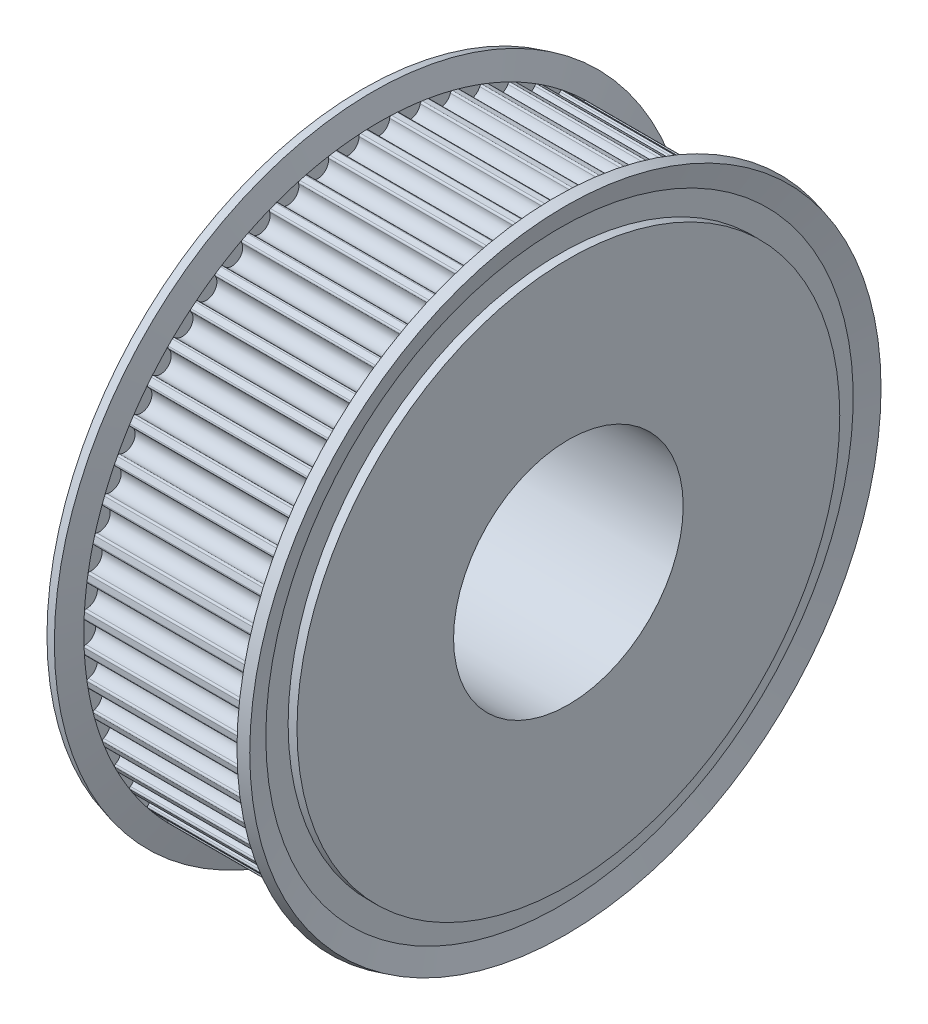
from build123d import *

# Parameters (mm, degrees)
CUT_EXTRUDE1_DEPTH       = 8.15
CUT_EXTRUDE1_DEPTH_BACK  = 8.15
CUT_EXTRUDE2_DEPTH       = 8.15
CUT_EXTRUDE2_DEPTH_BACK  = 8.15
CUT_EXTRUDE3_DEPTH       = 8.15
CUT_EXTRUDE3_DEPTH_BACK  = 8.15
CUT_EXTRUDE4_DEPTH       = 8.15
CUT_EXTRUDE4_DEPTH_BACK  = 8.15
CUT_EXTRUDE5_DEPTH       = 8.15
CUT_EXTRUDE5_DEPTH_BACK  = 8.15
CUT_EXTRUDE6_DEPTH       = 8.15
CUT_EXTRUDE6_DEPTH_BACK  = 8.15
CUT_EXTRUDE7_DEPTH       = 8.15
CUT_EXTRUDE7_DEPTH_BACK  = 8.15
CUT_EXTRUDE8_DEPTH       = 8.15
CUT_EXTRUDE8_DEPTH_BACK  = 8.15
CUT_EXTRUDE9_DEPTH       = 8.15
CUT_EXTRUDE9_DEPTH_BACK  = 8.15
CUT_EXTRUDE10_DEPTH      = 8.15
CUT_EXTRUDE10_DEPTH_BACK = 8.15
CUT_EXTRUDE11_DEPTH      = 8.15
CUT_EXTRUDE11_DEPTH_BACK = 8.15
CUT_EXTRUDE12_DEPTH      = 8.15
CUT_EXTRUDE12_DEPTH_BACK = 8.15
CUT_EXTRUDE13_DEPTH      = 8.15
CUT_EXTRUDE13_DEPTH_BACK = 8.15
CUT_EXTRUDE14_DEPTH      = 8.15
CUT_EXTRUDE14_DEPTH_BACK = 8.15
CUT_EXTRUDE15_DEPTH      = 8.15
CUT_EXTRUDE15_DEPTH_BACK = 8.15
CUT_EXTRUDE16_DEPTH      = 8.15
CUT_EXTRUDE16_DEPTH_BACK = 8.15
CUT_EXTRUDE17_DEPTH      = 8.15
CUT_EXTRUDE17_DEPTH_BACK = 8.15
CUT_EXTRUDE18_DEPTH      = 8.15
CUT_EXTRUDE18_DEPTH_BACK = 8.15
CUT_EXTRUDE19_DEPTH      = 8.15
CUT_EXTRUDE19_DEPTH_BACK = 8.15
CUT_EXTRUDE20_DEPTH      = 8.15
CUT_EXTRUDE20_DEPTH_BACK = 8.15
CUT_EXTRUDE21_DEPTH      = 8.15
CUT_EXTRUDE21_DEPTH_BACK = 8.15
CUT_EXTRUDE22_DEPTH      = 8.15
CUT_EXTRUDE22_DEPTH_BACK = 8.15
CUT_EXTRUDE23_DEPTH      = 8.15
CUT_EXTRUDE23_DEPTH_BACK = 8.15
CUT_EXTRUDE24_DEPTH      = 8.15
CUT_EXTRUDE24_DEPTH_BACK = 8.15
CUT_EXTRUDE25_DEPTH      = 8.15
CUT_EXTRUDE25_DEPTH_BACK = 8.15
CUT_EXTRUDE26_DEPTH      = 8.15
CUT_EXTRUDE26_DEPTH_BACK = 8.15
CUT_EXTRUDE27_DEPTH      = 8.15
CUT_EXTRUDE27_DEPTH_BACK = 8.15
CUT_EXTRUDE28_DEPTH      = 8.15
CUT_EXTRUDE28_DEPTH_BACK = 8.15
CUT_EXTRUDE29_DEPTH      = 8.15
CUT_EXTRUDE29_DEPTH_BACK = 8.15
CUT_EXTRUDE30_DEPTH      = 8.15
CUT_EXTRUDE30_DEPTH_BACK = 8.15
CUT_EXTRUDE31_DEPTH      = 8.15
CUT_EXTRUDE31_DEPTH_BACK = 8.15
CUT_EXTRUDE32_DEPTH      = 8.15
CUT_EXTRUDE32_DEPTH_BACK = 8.15
CUT_EXTRUDE33_DEPTH      = 8.15
CUT_EXTRUDE33_DEPTH_BACK = 8.15
CUT_EXTRUDE34_DEPTH      = 8.15
CUT_EXTRUDE34_DEPTH_BACK = 8.15
CUT_EXTRUDE35_DEPTH      = 8.15
CUT_EXTRUDE35_DEPTH_BACK = 8.15
CUT_EXTRUDE36_DEPTH      = 8.15
CUT_EXTRUDE36_DEPTH_BACK = 8.15
CUT_EXTRUDE37_DEPTH      = 8.15
CUT_EXTRUDE37_DEPTH_BACK = 8.15
CUT_EXTRUDE38_DEPTH      = 8.15
CUT_EXTRUDE38_DEPTH_BACK = 8.15
CUT_EXTRUDE39_DEPTH      = 8.15
CUT_EXTRUDE39_DEPTH_BACK = 8.15
CUT_EXTRUDE40_DEPTH      = 8.15
CUT_EXTRUDE40_DEPTH_BACK = 8.15
CUT_EXTRUDE41_DEPTH      = 8.15
CUT_EXTRUDE41_DEPTH_BACK = 8.15
CUT_EXTRUDE42_DEPTH      = 8.15
CUT_EXTRUDE42_DEPTH_BACK = 8.15
CUT_EXTRUDE43_DEPTH      = 8.15
CUT_EXTRUDE43_DEPTH_BACK = 8.15
CUT_EXTRUDE44_DEPTH      = 8.15
CUT_EXTRUDE44_DEPTH_BACK = 8.15
CUT_EXTRUDE45_DEPTH      = 8.15
CUT_EXTRUDE45_DEPTH_BACK = 8.15
CUT_EXTRUDE46_DEPTH      = 8.15
CUT_EXTRUDE46_DEPTH_BACK = 8.15
CUT_EXTRUDE47_DEPTH      = 8.15
CUT_EXTRUDE47_DEPTH_BACK = 8.15
CUT_EXTRUDE48_DEPTH      = 8.15
CUT_EXTRUDE48_DEPTH_BACK = 8.15
CUT_EXTRUDE49_DEPTH      = 8.15
CUT_EXTRUDE49_DEPTH_BACK = 8.15
CUT_EXTRUDE50_DEPTH      = 8.15
CUT_EXTRUDE50_DEPTH_BACK = 8.15
CUT_EXTRUDE51_DEPTH      = 8.15
CUT_EXTRUDE51_DEPTH_BACK = 8.15
CUT_EXTRUDE52_DEPTH      = 8.15
CUT_EXTRUDE52_DEPTH_BACK = 8.15
CUT_EXTRUDE53_DEPTH      = 8.15
CUT_EXTRUDE53_DEPTH_BACK = 8.15
CUT_EXTRUDE54_DEPTH      = 8.15
CUT_EXTRUDE54_DEPTH_BACK = 8.15
CUT_EXTRUDE55_DEPTH      = 8.15
CUT_EXTRUDE55_DEPTH_BACK = 8.15
CUT_EXTRUDE56_DEPTH      = 8.15
CUT_EXTRUDE56_DEPTH_BACK = 8.15
CUT_EXTRUDE57_DEPTH      = 8.15
CUT_EXTRUDE57_DEPTH_BACK = 8.15
CUT_EXTRUDE58_DEPTH      = 8.15
CUT_EXTRUDE58_DEPTH_BACK = 8.15
CUT_EXTRUDE59_DEPTH      = 8.15
CUT_EXTRUDE59_DEPTH_BACK = 8.15
CUT_EXTRUDE60_DEPTH      = 8.15
CUT_EXTRUDE60_DEPTH_BACK = 8.15
SKETCH62_W               = 20
SKETCH62_H               = 11


with BuildPart() as part:
    # Sketch1 → Revolve1 (revolve)
    with BuildSketch(Plane.XY):
        Polygon((0, 0), (0, 26), (0.85, 26), (0.85, 28.138347502), (0.286547475, 30.241180955), (1.252473301, 30.5), (1.85, 28.27), (18.15, 28.27), (18.747526699, 30.5), (19.713452525, 30.241180955), (19.15, 28.138347502), (19.15, 26), (20, 26), (20, 0), align=None)
    revolve(axis=Axis((20, 0, 0), (-1, 0, 0)))

    # Sketch2 → Cut-Extrude1 (cut, two sides: drawn at the far end of the back side and taken through both)
    with BuildSketch(Plane(origin=(10, 0, 0), x_dir=(0, 0, -1), z_dir=(1, 0, 0)).offset(-CUT_EXTRUDE1_DEPTH_BACK)):
        with BuildLine():
            Line((-1.220377727, 28.623996545), (-1.204191216, 28.244341442))
            ThreePointArc((-1.204191216, 28.244341442), (-1.083780205, 28.201352445), (-1.027381979, 28.086608793))
            ThreePointArc((-1.027381979, 28.086608793), (5e-08, 27.13), (1.027381986, 28.086608894))
            ThreePointArc((1.027381986, 28.086608894), (1.083780242, 28.201352479), (1.204191216, 28.244341442))
            Line((1.204191216, 28.244341442), (1.220377727, 28.623996545))
            ThreePointArc((1.220377727, 28.623996545), (0, 28.65), (-1.220377727, 28.623996545))
        make_face()
    extrude(amount=CUT_EXTRUDE1_DEPTH + CUT_EXTRUDE1_DEPTH_BACK, mode=Mode.SUBTRACT)

    # Sketch3 → Cut-Extrude2 (cut, two sides: drawn at the far end of the back side and taken through both)
    with BuildSketch(Plane(origin=(10, 0, 0), x_dir=(0, 0, -1), z_dir=(1, 0, 0)).offset(-CUT_EXTRUDE2_DEPTH_BACK)):
        with BuildLine():
            Line((-4.205714742, 28.339627088), (-4.149932138, 27.963743727))
            ThreePointArc((-4.149932138, 27.963743727), (-4.025687177, 27.933576607), (-3.957603929, 27.825356752))
            ThreePointArc((-3.957603929, 27.825356752), (-2.835857158, 26.981379027), (-1.914096186, 28.040138172))
            ThreePointArc((-1.914096186, 28.040138172), (-1.870000856, 28.160148403), (-1.754743076, 28.215488242))
            Line((-1.754743076, 28.215488242), (-1.778330001, 28.594755505))
            ThreePointArc((-1.778330001, 28.594755505), (-2.994740473, 28.493052302), (-4.205714742, 28.339627088))
        make_face()
    extrude(amount=CUT_EXTRUDE2_DEPTH + CUT_EXTRUDE2_DEPTH_BACK, mode=Mode.SUBTRACT)

    # Sketch4 → Cut-Extrude3 (cut, two sides: drawn at the far end of the back side and taken through both)
    with BuildSketch(Plane(origin=(10, 0, 0), x_dir=(0, 0, -1), z_dir=(1, 0, 0)).offset(-CUT_EXTRUDE3_DEPTH_BACK)):
        with BuildLine():
            Line((-7.144973065, 27.744762747), (-7.050205534, 27.376769384))
            ThreePointArc((-7.050205534, 27.376769384), (-6.923487877, 27.359754657), (-6.844465541, 27.25924428))
            ThreePointArc((-6.844465541, 27.25924428), (-5.640644123, 26.537144418), (-4.83460312, 27.686453828))
            ThreePointArc((-4.83460312, 27.686453828), (-4.803293833, 27.810415847), (-4.694452036, 27.877500248))
            Line((-4.694452036, 27.877500248), (-4.757553974, 28.252224341))
            ThreePointArc((-4.757553974, 28.252224341), (-5.956669942, 28.023928761), (-7.144973065, 27.744762747))
        make_face()
    extrude(amount=CUT_EXTRUDE3_DEPTH + CUT_EXTRUDE3_DEPTH_BACK, mode=Mode.SUBTRACT)

    # Sketch5 → Cut-Extrude4 (cut, two sides: drawn at the far end of the back side and taken through both)
    with BuildSketch(Plane(origin=(10, 0, 0), x_dir=(0, 0, -1), z_dir=(1, 0, 0)).offset(-CUT_EXTRUDE4_DEPTH_BACK)):
        with BuildLine():
            Line((-10.005949569, 26.845920979), (-9.873235404, 26.489849427))
            ThreePointArc((-9.873235404, 26.489849427), (-9.745433396, 26.48617351), (-9.656337757, 26.394473822))
            ThreePointArc((-9.656337757, 26.394473822), (-8.383631009, 25.802163303), (-7.70214113, 27.029430903))
            ThreePointArc((-7.70214113, 27.029430903), (-7.683960919, 27.155986556), (-7.582727597, 27.234080528))
            Line((-7.582727597, 27.234080528), (-7.68465319, 27.600155894))
            ThreePointArc((-7.68465319, 27.600155894), (-8.853336889, 27.247769192), (-10.005949569, 26.845920979))
        make_face()
    extrude(amount=CUT_EXTRUDE4_DEPTH + CUT_EXTRUDE4_DEPTH_BACK, mode=Mode.SUBTRACT)

    # Sketch6 → Cut-Extrude5 (cut, two sides: drawn at the far end of the back side and taken through both)
    with BuildSketch(Plane(origin=(10, 0, 0), x_dir=(0, 0, -1), z_dir=(1, 0, 0)).offset(-CUT_EXTRUDE5_DEPTH_BACK)):
        with BuildLine():
            Line((-12.757298795, 25.652949683), (-12.58809204, 25.312701136))
            ThreePointArc((-12.58809204, 25.312701136), (-12.460605907, 25.322404304), (-12.362413116, 25.240519986))
            ThreePointArc((-12.362413116, 25.240519986), (-11.034765081, 24.784488286), (-10.48529287, 26.076267876))
            ThreePointArc((-10.48529287, 26.076267876), (-10.48044092, 26.204030594), (-10.387925208, 26.292278522))
            Line((-10.387925208, 26.292278522), (-10.527557737, 26.645694363))
            ThreePointArc((-10.527557737, 26.645694363), (-11.653004824, 26.173077361), (-12.757298795, 25.652949683))
        make_face()
    extrude(amount=CUT_EXTRUDE5_DEPTH + CUT_EXTRUDE5_DEPTH_BACK, mode=Mode.SUBTRACT)

    # Sketch7 → Cut-Extrude6 (cut, two sides: drawn at the far end of the back side and taken through both)
    with BuildSketch(Plane(origin=(10, 0, 0), x_dir=(0, 0, -1), z_dir=(1, 0, 0)).offset(-CUT_EXTRUDE6_DEPTH_BACK)):
        with BuildLine():
            Line((-15.368876386, 24.178919302), (-15.165030906, 23.858221594))
            ThreePointArc((-15.165030906, 23.858221594), (-15.039257412, 23.881197536), (-14.93304329, 23.810025732))
            ThreePointArc((-14.93304329, 23.810025732), (-13.564999956, 23.49526923), (-13.153565547, 24.837407801))
            ThreePointArc((-13.153565547, 24.837407801), (-13.162095017, 24.964977789), (-13.079310537, 25.06241281))
            Line((-13.079310537, 25.06241281), (-13.255120158, 25.399297029))
            ThreePointArc((-13.255120158, 25.399297029), (-14.325, 24.811627818), (-15.368876386, 24.178919302))
        make_face()
    extrude(amount=CUT_EXTRUDE6_DEPTH + CUT_EXTRUDE6_DEPTH_BACK, mode=Mode.SUBTRACT)

    # Sketch8 → Cut-Extrude7 (cut, two sides: drawn at the far end of the back side and taken through both)
    with BuildSketch(Plane(origin=(10, 0, 0), x_dir=(0, 0, -1), z_dir=(1, 0, 0)).offset(-CUT_EXTRUDE7_DEPTH_BACK)):
        with BuildLine():
            Line((-17.812069352, 22.439979621), (-17.575818519, 22.142346384))
            ThreePointArc((-17.575818519, 22.142346384), (-17.453135666, 22.178343372), (-17.340063916, 22.118663852))
            ThreePointArc((-17.340063916, 22.118663852), (-15.946613854, 21.948631087), (-15.677725008, 23.326423889))
            ThreePointArc((-15.677725008, 23.326423889), (-15.699542448, 23.452403463), (-15.627396202, 23.55795806))
            Line((-15.627396202, 23.55795806), (-15.83745671, 23.874619682))
            ThreePointArc((-15.83745671, 23.874619682), (-16.840047478, 23.178336889), (-17.812069352, 22.439979621))
        make_face()
    extrude(amount=CUT_EXTRUDE7_DEPTH + CUT_EXTRUDE7_DEPTH_BACK, mode=Mode.SUBTRACT)

    # Sketch9 → Cut-Extrude8 (cut, two sides: drawn at the far end of the back side and taken through both)
    with BuildSketch(Plane(origin=(10, 0, 0), x_dir=(0, 0, -1), z_dir=(1, 0, 0)).offset(-CUT_EXTRUDE8_DEPTH_BACK)):
        with BuildLine():
            Line((-20.060109558, 20.455182828), (-19.794041787, 20.183874993))
            ThreePointArc((-19.794041787, 20.183874993), (-19.675793713, 20.232498636), (-19.557103174, 20.184965263))
            ThreePointArc((-19.557103174, 20.184965263), (-18.153513313, 20.161519149), (-18.030116033, 21.559870796))
            ThreePointArc((-18.030116033, 21.559870796), (-18.064982405, 21.682879697), (-18.004264844, 21.795397391))
            Line((-18.004264844, 21.795397391), (-18.246274771, 22.088367005))
            ThreePointArc((-18.246274771, 22.088367005), (-19.170591872, 21.29109925), (-20.060109558, 20.455182828))
        make_face()
    extrude(amount=CUT_EXTRUDE8_DEPTH + CUT_EXTRUDE8_DEPTH_BACK, mode=Mode.SUBTRACT)

    # Sketch10 → Cut-Extrude9 (cut, two sides: drawn at the far end of the back side and taken through both)
    with BuildSketch(Plane(origin=(10, 0, 0), x_dir=(0, 0, -1), z_dir=(1, 0, 0)).offset(-CUT_EXTRUDE9_DEPTH_BACK)):
        with BuildLine():
            Line((-22.088367005, 18.246274771), (-21.795397391, 18.004264844))
            ThreePointArc((-21.795397391, 18.004264844), (-21.682879647, 18.064982411), (-21.559870717, 18.030115971))
            ThreePointArc((-21.559870717, 18.030115971), (-20.161519081, 18.153513388), (-20.184965333, 19.557103247))
            ThreePointArc((-20.184965333, 19.557103247), (-20.232498635, 19.675793763), (-20.183874993, 19.794041787))
            Line((-20.183874993, 19.794041787), (-20.455182828, 20.060109558))
            ThreePointArc((-20.455182828, 20.060109558), (-21.29109925, 19.170591872), (-22.088367005, 18.246274771))
        make_face()
    extrude(amount=CUT_EXTRUDE9_DEPTH + CUT_EXTRUDE9_DEPTH_BACK, mode=Mode.SUBTRACT)

    # Sketch11 → Cut-Extrude10 (cut, two sides: drawn at the far end of the back side and taken through both)
    with BuildSketch(Plane(origin=(10, 0, 0), x_dir=(0, 0, -1), z_dir=(1, 0, 0)).offset(-CUT_EXTRUDE10_DEPTH_BACK)):
        with BuildLine():
            Line((-23.874619682, 15.83745671), (-23.55795806, 15.627396202))
            ThreePointArc((-23.55795806, 15.627396202), (-23.452403414, 15.699542458), (-23.326423804, 15.677724955))
            ThreePointArc((-23.326423804, 15.677724955), (-21.948631028, 15.946613935), (-22.11866393, 17.340063981))
            ThreePointArc((-22.11866393, 17.340063981), (-22.178343377, 17.453135716), (-22.142346384, 17.575818519))
            Line((-22.142346384, 17.575818519), (-22.439979621, 17.812069352))
            ThreePointArc((-22.439979621, 17.812069352), (-23.178336889, 16.840047478), (-23.874619682, 15.83745671))
        make_face()
    extrude(amount=CUT_EXTRUDE10_DEPTH + CUT_EXTRUDE10_DEPTH_BACK, mode=Mode.SUBTRACT)

    # Sketch12 → Cut-Extrude11 (cut, two sides: drawn at the far end of the back side and taken through both)
    with BuildSketch(Plane(origin=(10, 0, 0), x_dir=(0, 0, -1), z_dir=(1, 0, 0)).offset(-CUT_EXTRUDE11_DEPTH_BACK)):
        with BuildLine():
            Line((-25.399297029, 13.255120158), (-25.06241281, 13.079310537))
            ThreePointArc((-25.06241281, 13.079310537), (-24.964977741, 13.162095033), (-24.837407711, 13.153565503))
            ThreePointArc((-24.837407711, 13.153565503), (-23.495269179, 13.565000044), (-23.810025815, 14.933043346))
            ThreePointArc((-23.810025815, 14.933043346), (-23.881197547, 15.039257461), (-23.858221594, 15.165030906))
            Line((-23.858221594, 15.165030906), (-24.178919302, 15.368876386))
            ThreePointArc((-24.178919302, 15.368876386), (-24.811627818, 14.325), (-25.399297029, 13.255120158))
        make_face()
    extrude(amount=CUT_EXTRUDE11_DEPTH + CUT_EXTRUDE11_DEPTH_BACK, mode=Mode.SUBTRACT)

    # Sketch13 → Cut-Extrude12 (cut, two sides: drawn at the far end of the back side and taken through both)
    with BuildSketch(Plane(origin=(10, 0, 0), x_dir=(0, 0, -1), z_dir=(1, 0, 0)).offset(-CUT_EXTRUDE12_DEPTH_BACK)):
        with BuildLine():
            Line((-26.645694363, 10.527557737), (-26.292278522, 10.387925208))
            ThreePointArc((-26.292278522, 10.387925208), (-26.204030548, 10.480440941), (-26.076267781, 10.485292836))
            ThreePointArc((-26.076267781, 10.485292836), (-24.784488245, 11.034765173), (-25.240520075, 12.362413164))
            ThreePointArc((-25.240520075, 12.362413164), (-25.322404319, 12.460605955), (-25.312701136, 12.58809204))
            Line((-25.312701136, 12.58809204), (-25.652949683, 12.757298795))
            ThreePointArc((-25.652949683, 12.757298795), (-26.173077361, 11.653004824), (-26.645694363, 10.527557737))
        make_face()
    extrude(amount=CUT_EXTRUDE12_DEPTH + CUT_EXTRUDE12_DEPTH_BACK, mode=Mode.SUBTRACT)

    # Sketch14 → Cut-Extrude13 (cut, two sides: drawn at the far end of the back side and taken through both)
    with BuildSketch(Plane(origin=(10, 0, 0), x_dir=(0, 0, -1), z_dir=(1, 0, 0)).offset(-CUT_EXTRUDE13_DEPTH_BACK)):
        with BuildLine():
            Line((-27.600155894, 7.68465319), (-27.234080528, 7.582727597))
            ThreePointArc((-27.234080528, 7.582727597), (-27.155986513, 7.683960944), (-27.029430805, 7.702141106))
            ThreePointArc((-27.029430805, 7.702141106), (-25.802163272, 8.383631105), (-26.394473916, 9.656337795))
            ThreePointArc((-26.394473916, 9.656337795), (-26.48617353, 9.745433442), (-26.489849427, 9.873235404))
            Line((-26.489849427, 9.873235404), (-26.845920979, 10.005949569))
            ThreePointArc((-26.845920979, 10.005949569), (-27.247769192, 8.853336889), (-27.600155894, 7.68465319))
        make_face()
    extrude(amount=CUT_EXTRUDE13_DEPTH + CUT_EXTRUDE13_DEPTH_BACK, mode=Mode.SUBTRACT)

    # Sketch15 → Cut-Extrude14 (cut, two sides: drawn at the far end of the back side and taken through both)
    with BuildSketch(Plane(origin=(10, 0, 0), x_dir=(0, 0, -1), z_dir=(1, 0, 0)).offset(-CUT_EXTRUDE14_DEPTH_BACK)):
        with BuildLine():
            Line((-28.252224341, 4.757553974), (-27.877500248, 4.694452036))
            ThreePointArc((-27.877500248, 4.694452036), (-27.810415807, 4.803293863), (-27.686453728, 4.834603106))
            ThreePointArc((-27.686453728, 4.834603106), (-26.537144397, 5.640644221), (-27.259244376, 6.844465569))
            ThreePointArc((-27.259244376, 6.844465569), (-27.359754682, 6.923487921), (-27.376769384, 7.050205534))
            Line((-27.376769384, 7.050205534), (-27.744762747, 7.144973065))
            ThreePointArc((-27.744762747, 7.144973065), (-28.023928761, 5.956669942), (-28.252224341, 4.757553974))
        make_face()
    extrude(amount=CUT_EXTRUDE14_DEPTH + CUT_EXTRUDE14_DEPTH_BACK, mode=Mode.SUBTRACT)

    # Sketch16 → Cut-Extrude15 (cut, two sides: drawn at the far end of the back side and taken through both)
    with BuildSketch(Plane(origin=(10, 0, 0), x_dir=(0, 0, -1), z_dir=(1, 0, 0)).offset(-CUT_EXTRUDE15_DEPTH_BACK)):
        with BuildLine():
            Line((-28.594755505, 1.778330001), (-28.215488242, 1.754743076))
            ThreePointArc((-28.215488242, 1.754743076), (-28.160148365, 1.87000089), (-28.040138071, 1.914096183))
            ThreePointArc((-28.040138071, 1.914096183), (-26.981379016, 2.835857259), (-27.825356851, 3.957603946))
            ThreePointArc((-27.825356851, 3.957603946), (-27.933576636, 4.025687218), (-27.963743727, 4.149932138))
            Line((-27.963743727, 4.149932138), (-28.339627088, 4.205714742))
            ThreePointArc((-28.339627088, 4.205714742), (-28.493052302, 2.994740473), (-28.594755505, 1.778330001))
        make_face()
    extrude(amount=CUT_EXTRUDE15_DEPTH + CUT_EXTRUDE15_DEPTH_BACK, mode=Mode.SUBTRACT)

    # Sketch17 → Cut-Extrude16 (cut, two sides: drawn at the far end of the back side and taken through both)
    with BuildSketch(Plane(origin=(10, 0, 0), x_dir=(0, 0, -1), z_dir=(1, 0, 0)).offset(-CUT_EXTRUDE16_DEPTH_BACK)):
        with BuildLine():
            Line((-28.623996545, -1.220377727), (-28.244341442, -1.204191216))
            ThreePointArc((-28.244341442, -1.204191216), (-28.201352445, -1.083780205), (-28.086608793, -1.027381979))
            ThreePointArc((-28.086608793, -1.027381979), (-27.13, 5e-08), (-28.086608894, 1.027381986))
            ThreePointArc((-28.086608894, 1.027381986), (-28.201352479, 1.083780242), (-28.244341442, 1.204191216))
            Line((-28.244341442, 1.204191216), (-28.623996545, 1.220377727))
            ThreePointArc((-28.623996545, 1.220377727), (-28.65, 0), (-28.623996545, -1.220377727))
        make_face()
    extrude(amount=CUT_EXTRUDE16_DEPTH + CUT_EXTRUDE16_DEPTH_BACK, mode=Mode.SUBTRACT)

    # Sketch18 → Cut-Extrude17 (cut, two sides: drawn at the far end of the back side and taken through both)
    with BuildSketch(Plane(origin=(10, 0, 0), x_dir=(0, 0, -1), z_dir=(1, 0, 0)).offset(-CUT_EXTRUDE17_DEPTH_BACK)):
        with BuildLine():
            Line((-28.339627088, -4.205714742), (-27.963743727, -4.149932138))
            ThreePointArc((-27.963743727, -4.149932138), (-27.933576607, -4.025687177), (-27.825356752, -3.957603929))
            ThreePointArc((-27.825356752, -3.957603929), (-26.981379027, -2.835857158), (-28.040138172, -1.914096186))
            ThreePointArc((-28.040138172, -1.914096186), (-28.160148403, -1.870000856), (-28.215488242, -1.754743076))
            Line((-28.215488242, -1.754743076), (-28.594755505, -1.778330001))
            ThreePointArc((-28.594755505, -1.778330001), (-28.493052302, -2.994740473), (-28.339627088, -4.205714742))
        make_face()
    extrude(amount=CUT_EXTRUDE17_DEPTH + CUT_EXTRUDE17_DEPTH_BACK, mode=Mode.SUBTRACT)

    # Sketch19 → Cut-Extrude18 (cut, two sides: drawn at the far end of the back side and taken through both)
    with BuildSketch(Plane(origin=(10, 0, 0), x_dir=(0, 0, -1), z_dir=(1, 0, 0)).offset(-CUT_EXTRUDE18_DEPTH_BACK)):
        with BuildLine():
            Line((-27.744762747, -7.144973065), (-27.376769384, -7.050205534))
            ThreePointArc((-27.376769384, -7.050205534), (-27.359754657, -6.923487877), (-27.25924428, -6.844465541))
            ThreePointArc((-27.25924428, -6.844465541), (-26.537144418, -5.640644123), (-27.686453828, -4.83460312))
            ThreePointArc((-27.686453828, -4.83460312), (-27.810415847, -4.803293833), (-27.877500248, -4.694452036))
            Line((-27.877500248, -4.694452036), (-28.252224341, -4.757553974))
            ThreePointArc((-28.252224341, -4.757553974), (-28.023928761, -5.956669942), (-27.744762747, -7.144973065))
        make_face()
    extrude(amount=CUT_EXTRUDE18_DEPTH + CUT_EXTRUDE18_DEPTH_BACK, mode=Mode.SUBTRACT)

    # Sketch20 → Cut-Extrude19 (cut, two sides: drawn at the far end of the back side and taken through both)
    with BuildSketch(Plane(origin=(10, 0, 0), x_dir=(0, 0, -1), z_dir=(1, 0, 0)).offset(-CUT_EXTRUDE19_DEPTH_BACK)):
        with BuildLine():
            Line((-26.845920979, -10.005949569), (-26.489849427, -9.873235404))
            ThreePointArc((-26.489849427, -9.873235404), (-26.48617351, -9.745433396), (-26.394473822, -9.656337757))
            ThreePointArc((-26.394473822, -9.656337757), (-25.802163303, -8.383631009), (-27.029430903, -7.70214113))
            ThreePointArc((-27.029430903, -7.70214113), (-27.155986556, -7.683960919), (-27.234080528, -7.582727597))
            Line((-27.234080528, -7.582727597), (-27.600155894, -7.68465319))
            ThreePointArc((-27.600155894, -7.68465319), (-27.247769192, -8.853336889), (-26.845920979, -10.005949569))
        make_face()
    extrude(amount=CUT_EXTRUDE19_DEPTH + CUT_EXTRUDE19_DEPTH_BACK, mode=Mode.SUBTRACT)

    # Sketch21 → Cut-Extrude20 (cut, two sides: drawn at the far end of the back side and taken through both)
    with BuildSketch(Plane(origin=(10, 0, 0), x_dir=(0, 0, -1), z_dir=(1, 0, 0)).offset(-CUT_EXTRUDE20_DEPTH_BACK)):
        with BuildLine():
            Line((-25.652949683, -12.757298795), (-25.312701136, -12.58809204))
            ThreePointArc((-25.312701136, -12.58809204), (-25.322404304, -12.460605907), (-25.240519986, -12.362413116))
            ThreePointArc((-25.240519986, -12.362413116), (-24.784488286, -11.034765081), (-26.076267876, -10.48529287))
            ThreePointArc((-26.076267876, -10.48529287), (-26.204030594, -10.48044092), (-26.292278522, -10.387925208))
            Line((-26.292278522, -10.387925208), (-26.645694363, -10.527557737))
            ThreePointArc((-26.645694363, -10.527557737), (-26.173077361, -11.653004824), (-25.652949683, -12.757298795))
        make_face()
    extrude(amount=CUT_EXTRUDE20_DEPTH + CUT_EXTRUDE20_DEPTH_BACK, mode=Mode.SUBTRACT)

    # Sketch22 → Cut-Extrude21 (cut, two sides: drawn at the far end of the back side and taken through both)
    with BuildSketch(Plane(origin=(10, 0, 0), x_dir=(0, 0, -1), z_dir=(1, 0, 0)).offset(-CUT_EXTRUDE21_DEPTH_BACK)):
        with BuildLine():
            Line((-24.178919302, -15.368876386), (-23.858221594, -15.165030906))
            ThreePointArc((-23.858221594, -15.165030906), (-23.881197536, -15.039257412), (-23.810025732, -14.93304329))
            ThreePointArc((-23.810025732, -14.93304329), (-23.49526923, -13.564999956), (-24.837407801, -13.153565547))
            ThreePointArc((-24.837407801, -13.153565547), (-24.964977789, -13.162095017), (-25.06241281, -13.079310537))
            Line((-25.06241281, -13.079310537), (-25.399297029, -13.255120158))
            ThreePointArc((-25.399297029, -13.255120158), (-24.811627818, -14.325), (-24.178919302, -15.368876386))
        make_face()
    extrude(amount=CUT_EXTRUDE21_DEPTH + CUT_EXTRUDE21_DEPTH_BACK, mode=Mode.SUBTRACT)

    # Sketch23 → Cut-Extrude22 (cut, two sides: drawn at the far end of the back side and taken through both)
    with BuildSketch(Plane(origin=(10, 0, 0), x_dir=(0, 0, -1), z_dir=(1, 0, 0)).offset(-CUT_EXTRUDE22_DEPTH_BACK)):
        with BuildLine():
            Line((-22.439979621, -17.812069352), (-22.142346384, -17.575818519))
            ThreePointArc((-22.142346384, -17.575818519), (-22.178343372, -17.453135666), (-22.118663852, -17.340063916))
            ThreePointArc((-22.118663852, -17.340063916), (-21.948631087, -15.946613854), (-23.326423889, -15.677725008))
            ThreePointArc((-23.326423889, -15.677725008), (-23.452403463, -15.699542448), (-23.55795806, -15.627396202))
            Line((-23.55795806, -15.627396202), (-23.874619682, -15.83745671))
            ThreePointArc((-23.874619682, -15.83745671), (-23.178336889, -16.840047478), (-22.439979621, -17.812069352))
        make_face()
    extrude(amount=CUT_EXTRUDE22_DEPTH + CUT_EXTRUDE22_DEPTH_BACK, mode=Mode.SUBTRACT)

    # Sketch24 → Cut-Extrude23 (cut, two sides: drawn at the far end of the back side and taken through both)
    with BuildSketch(Plane(origin=(10, 0, 0), x_dir=(0, 0, -1), z_dir=(1, 0, 0)).offset(-CUT_EXTRUDE23_DEPTH_BACK)):
        with BuildLine():
            Line((-20.455182828, -20.060109558), (-20.183874993, -19.794041787))
            ThreePointArc((-20.183874993, -19.794041787), (-20.232498636, -19.675793713), (-20.184965263, -19.557103174))
            ThreePointArc((-20.184965263, -19.557103174), (-20.161519149, -18.153513313), (-21.559870796, -18.030116033))
            ThreePointArc((-21.559870796, -18.030116033), (-21.682879697, -18.064982405), (-21.795397391, -18.004264844))
            Line((-21.795397391, -18.004264844), (-22.088367005, -18.246274771))
            ThreePointArc((-22.088367005, -18.246274771), (-21.29109925, -19.170591872), (-20.455182828, -20.060109558))
        make_face()
    extrude(amount=CUT_EXTRUDE23_DEPTH + CUT_EXTRUDE23_DEPTH_BACK, mode=Mode.SUBTRACT)

    # Sketch25 → Cut-Extrude24 (cut, two sides: drawn at the far end of the back side and taken through both)
    with BuildSketch(Plane(origin=(10, 0, 0), x_dir=(0, 0, -1), z_dir=(1, 0, 0)).offset(-CUT_EXTRUDE24_DEPTH_BACK)):
        with BuildLine():
            Line((-18.246274771, -22.088367005), (-18.004264844, -21.795397391))
            ThreePointArc((-18.004264844, -21.795397391), (-18.064982411, -21.682879647), (-18.030115971, -21.559870717))
            ThreePointArc((-18.030115971, -21.559870717), (-18.153513388, -20.161519081), (-19.557103247, -20.184965333))
            ThreePointArc((-19.557103247, -20.184965333), (-19.675793763, -20.232498635), (-19.794041787, -20.183874993))
            Line((-19.794041787, -20.183874993), (-20.060109558, -20.455182828))
            ThreePointArc((-20.060109558, -20.455182828), (-19.170591872, -21.29109925), (-18.246274771, -22.088367005))
        make_face()
    extrude(amount=CUT_EXTRUDE24_DEPTH + CUT_EXTRUDE24_DEPTH_BACK, mode=Mode.SUBTRACT)

    # Sketch26 → Cut-Extrude25 (cut, two sides: drawn at the far end of the back side and taken through both)
    with BuildSketch(Plane(origin=(10, 0, 0), x_dir=(0, 0, -1), z_dir=(1, 0, 0)).offset(-CUT_EXTRUDE25_DEPTH_BACK)):
        with BuildLine():
            Line((-15.83745671, -23.874619682), (-15.627396202, -23.55795806))
            ThreePointArc((-15.627396202, -23.55795806), (-15.699542458, -23.452403414), (-15.677724955, -23.326423804))
            ThreePointArc((-15.677724955, -23.326423804), (-15.946613935, -21.948631028), (-17.340063981, -22.11866393))
            ThreePointArc((-17.340063981, -22.11866393), (-17.453135716, -22.178343377), (-17.575818519, -22.142346384))
            Line((-17.575818519, -22.142346384), (-17.812069352, -22.439979621))
            ThreePointArc((-17.812069352, -22.439979621), (-16.840047478, -23.178336889), (-15.83745671, -23.874619682))
        make_face()
    extrude(amount=CUT_EXTRUDE25_DEPTH + CUT_EXTRUDE25_DEPTH_BACK, mode=Mode.SUBTRACT)

    # Sketch27 → Cut-Extrude26 (cut, two sides: drawn at the far end of the back side and taken through both)
    with BuildSketch(Plane(origin=(10, 0, 0), x_dir=(0, 0, -1), z_dir=(1, 0, 0)).offset(-CUT_EXTRUDE26_DEPTH_BACK)):
        with BuildLine():
            Line((-13.255120158, -25.399297029), (-13.079310537, -25.06241281))
            ThreePointArc((-13.079310537, -25.06241281), (-13.162095033, -24.964977741), (-13.153565503, -24.837407711))
            ThreePointArc((-13.153565503, -24.837407711), (-13.565000044, -23.495269179), (-14.933043346, -23.810025815))
            ThreePointArc((-14.933043346, -23.810025815), (-15.039257461, -23.881197547), (-15.165030906, -23.858221594))
            Line((-15.165030906, -23.858221594), (-15.368876386, -24.178919302))
            ThreePointArc((-15.368876386, -24.178919302), (-14.325, -24.811627818), (-13.255120158, -25.399297029))
        make_face()
    extrude(amount=CUT_EXTRUDE26_DEPTH + CUT_EXTRUDE26_DEPTH_BACK, mode=Mode.SUBTRACT)

    # Sketch28 → Cut-Extrude27 (cut, two sides: drawn at the far end of the back side and taken through both)
    with BuildSketch(Plane(origin=(10, 0, 0), x_dir=(0, 0, -1), z_dir=(1, 0, 0)).offset(-CUT_EXTRUDE27_DEPTH_BACK)):
        with BuildLine():
            Line((-10.527557737, -26.645694363), (-10.387925208, -26.292278522))
            ThreePointArc((-10.387925208, -26.292278522), (-10.480440941, -26.204030548), (-10.485292836, -26.076267781))
            ThreePointArc((-10.485292836, -26.076267781), (-11.034765173, -24.784488245), (-12.362413164, -25.240520075))
            ThreePointArc((-12.362413164, -25.240520075), (-12.460605955, -25.322404319), (-12.58809204, -25.312701136))
            Line((-12.58809204, -25.312701136), (-12.757298795, -25.652949683))
            ThreePointArc((-12.757298795, -25.652949683), (-11.653004824, -26.173077361), (-10.527557737, -26.645694363))
        make_face()
    extrude(amount=CUT_EXTRUDE27_DEPTH + CUT_EXTRUDE27_DEPTH_BACK, mode=Mode.SUBTRACT)

    # Sketch29 → Cut-Extrude28 (cut, two sides: drawn at the far end of the back side and taken through both)
    with BuildSketch(Plane(origin=(10, 0, 0), x_dir=(0, 0, -1), z_dir=(1, 0, 0)).offset(-CUT_EXTRUDE28_DEPTH_BACK)):
        with BuildLine():
            Line((-7.68465319, -27.600155894), (-7.582727597, -27.234080528))
            ThreePointArc((-7.582727597, -27.234080528), (-7.683960944, -27.155986513), (-7.702141106, -27.029430805))
            ThreePointArc((-7.702141106, -27.029430805), (-8.383631105, -25.802163272), (-9.656337795, -26.394473916))
            ThreePointArc((-9.656337795, -26.394473916), (-9.745433442, -26.48617353), (-9.873235404, -26.489849427))
            Line((-9.873235404, -26.489849427), (-10.005949569, -26.845920979))
            ThreePointArc((-10.005949569, -26.845920979), (-8.853336889, -27.247769192), (-7.68465319, -27.600155894))
        make_face()
    extrude(amount=CUT_EXTRUDE28_DEPTH + CUT_EXTRUDE28_DEPTH_BACK, mode=Mode.SUBTRACT)

    # Sketch30 → Cut-Extrude29 (cut, two sides: drawn at the far end of the back side and taken through both)
    with BuildSketch(Plane(origin=(10, 0, 0), x_dir=(0, 0, -1), z_dir=(1, 0, 0)).offset(-CUT_EXTRUDE29_DEPTH_BACK)):
        with BuildLine():
            Line((-4.757553974, -28.252224341), (-4.694452036, -27.877500248))
            ThreePointArc((-4.694452036, -27.877500248), (-4.803293863, -27.810415807), (-4.834603106, -27.686453728))
            ThreePointArc((-4.834603106, -27.686453728), (-5.640644221, -26.537144397), (-6.844465569, -27.259244376))
            ThreePointArc((-6.844465569, -27.259244376), (-6.923487921, -27.359754682), (-7.050205534, -27.376769384))
            Line((-7.050205534, -27.376769384), (-7.144973065, -27.744762747))
            ThreePointArc((-7.144973065, -27.744762747), (-5.956669942, -28.023928761), (-4.757553974, -28.252224341))
        make_face()
    extrude(amount=CUT_EXTRUDE29_DEPTH + CUT_EXTRUDE29_DEPTH_BACK, mode=Mode.SUBTRACT)

    # Sketch31 → Cut-Extrude30 (cut, two sides: drawn at the far end of the back side and taken through both)
    with BuildSketch(Plane(origin=(10, 0, 0), x_dir=(0, 0, -1), z_dir=(1, 0, 0)).offset(-CUT_EXTRUDE30_DEPTH_BACK)):
        with BuildLine():
            Line((-1.778330001, -28.594755505), (-1.754743076, -28.215488242))
            ThreePointArc((-1.754743076, -28.215488242), (-1.87000089, -28.160148365), (-1.914096183, -28.040138071))
            ThreePointArc((-1.914096183, -28.040138071), (-2.835857259, -26.981379016), (-3.957603946, -27.825356851))
            ThreePointArc((-3.957603946, -27.825356851), (-4.025687218, -27.933576636), (-4.149932138, -27.963743727))
            Line((-4.149932138, -27.963743727), (-4.205714742, -28.339627088))
            ThreePointArc((-4.205714742, -28.339627088), (-2.994740473, -28.493052302), (-1.778330001, -28.594755505))
        make_face()
    extrude(amount=CUT_EXTRUDE30_DEPTH + CUT_EXTRUDE30_DEPTH_BACK, mode=Mode.SUBTRACT)

    # Sketch32 → Cut-Extrude31 (cut, two sides: drawn at the far end of the back side and taken through both)
    with BuildSketch(Plane(origin=(10, 0, 0), x_dir=(0, 0, -1), z_dir=(1, 0, 0)).offset(-CUT_EXTRUDE31_DEPTH_BACK)):
        with BuildLine():
            Line((1.220377727, -28.623996545), (1.204191216, -28.244341442))
            ThreePointArc((1.204191216, -28.244341442), (1.083780205, -28.201352445), (1.027381979, -28.086608793))
            ThreePointArc((1.027381979, -28.086608793), (-5e-08, -27.13), (-1.027381986, -28.086608894))
            ThreePointArc((-1.027381986, -28.086608894), (-1.083780242, -28.201352479), (-1.204191216, -28.244341442))
            Line((-1.204191216, -28.244341442), (-1.220377727, -28.623996545))
            ThreePointArc((-1.220377727, -28.623996545), (0, -28.65), (1.220377727, -28.623996545))
        make_face()
    extrude(amount=CUT_EXTRUDE31_DEPTH + CUT_EXTRUDE31_DEPTH_BACK, mode=Mode.SUBTRACT)

    # Sketch33 → Cut-Extrude32 (cut, two sides: drawn at the far end of the back side and taken through both)
    with BuildSketch(Plane(origin=(10, 0, 0), x_dir=(0, 0, -1), z_dir=(1, 0, 0)).offset(-CUT_EXTRUDE32_DEPTH_BACK)):
        with BuildLine():
            Line((4.205714742, -28.339627088), (4.149932138, -27.963743727))
            ThreePointArc((4.149932138, -27.963743727), (4.025687177, -27.933576607), (3.957603929, -27.825356752))
            ThreePointArc((3.957603929, -27.825356752), (2.835857158, -26.981379027), (1.914096186, -28.040138172))
            ThreePointArc((1.914096186, -28.040138172), (1.870000856, -28.160148403), (1.754743076, -28.215488242))
            Line((1.754743076, -28.215488242), (1.778330001, -28.594755505))
            ThreePointArc((1.778330001, -28.594755505), (2.994740473, -28.493052302), (4.205714742, -28.339627088))
        make_face()
    extrude(amount=CUT_EXTRUDE32_DEPTH + CUT_EXTRUDE32_DEPTH_BACK, mode=Mode.SUBTRACT)

    # Sketch34 → Cut-Extrude33 (cut, two sides: drawn at the far end of the back side and taken through both)
    with BuildSketch(Plane(origin=(10, 0, 0), x_dir=(0, 0, -1), z_dir=(1, 0, 0)).offset(-CUT_EXTRUDE33_DEPTH_BACK)):
        with BuildLine():
            Line((7.144973065, -27.744762747), (7.050205534, -27.376769384))
            ThreePointArc((7.050205534, -27.376769384), (6.923487877, -27.359754657), (6.844465541, -27.25924428))
            ThreePointArc((6.844465541, -27.25924428), (5.640644123, -26.537144418), (4.83460312, -27.686453828))
            ThreePointArc((4.83460312, -27.686453828), (4.803293833, -27.810415847), (4.694452036, -27.877500248))
            Line((4.694452036, -27.877500248), (4.757553974, -28.252224341))
            ThreePointArc((4.757553974, -28.252224341), (5.956669942, -28.023928761), (7.144973065, -27.744762747))
        make_face()
    extrude(amount=CUT_EXTRUDE33_DEPTH + CUT_EXTRUDE33_DEPTH_BACK, mode=Mode.SUBTRACT)

    # Sketch35 → Cut-Extrude34 (cut, two sides: drawn at the far end of the back side and taken through both)
    with BuildSketch(Plane(origin=(10, 0, 0), x_dir=(0, 0, -1), z_dir=(1, 0, 0)).offset(-CUT_EXTRUDE34_DEPTH_BACK)):
        with BuildLine():
            Line((10.005949569, -26.845920979), (9.873235404, -26.489849427))
            ThreePointArc((9.873235404, -26.489849427), (9.745433396, -26.48617351), (9.656337757, -26.394473822))
            ThreePointArc((9.656337757, -26.394473822), (8.383631009, -25.802163303), (7.70214113, -27.029430903))
            ThreePointArc((7.70214113, -27.029430903), (7.683960919, -27.155986556), (7.582727597, -27.234080528))
            Line((7.582727597, -27.234080528), (7.68465319, -27.600155894))
            ThreePointArc((7.68465319, -27.600155894), (8.853336889, -27.247769192), (10.005949569, -26.845920979))
        make_face()
    extrude(amount=CUT_EXTRUDE34_DEPTH + CUT_EXTRUDE34_DEPTH_BACK, mode=Mode.SUBTRACT)

    # Sketch36 → Cut-Extrude35 (cut, two sides: drawn at the far end of the back side and taken through both)
    with BuildSketch(Plane(origin=(10, 0, 0), x_dir=(0, 0, -1), z_dir=(1, 0, 0)).offset(-CUT_EXTRUDE35_DEPTH_BACK)):
        with BuildLine():
            Line((12.757298795, -25.652949683), (12.58809204, -25.312701136))
            ThreePointArc((12.58809204, -25.312701136), (12.460605907, -25.322404304), (12.362413116, -25.240519986))
            ThreePointArc((12.362413116, -25.240519986), (11.034765081, -24.784488286), (10.48529287, -26.076267876))
            ThreePointArc((10.48529287, -26.076267876), (10.48044092, -26.204030594), (10.387925208, -26.292278522))
            Line((10.387925208, -26.292278522), (10.527557737, -26.645694363))
            ThreePointArc((10.527557737, -26.645694363), (11.653004824, -26.173077361), (12.757298795, -25.652949683))
        make_face()
    extrude(amount=CUT_EXTRUDE35_DEPTH + CUT_EXTRUDE35_DEPTH_BACK, mode=Mode.SUBTRACT)

    # Sketch37 → Cut-Extrude36 (cut, two sides: drawn at the far end of the back side and taken through both)
    with BuildSketch(Plane(origin=(10, 0, 0), x_dir=(0, 0, -1), z_dir=(1, 0, 0)).offset(-CUT_EXTRUDE36_DEPTH_BACK)):
        with BuildLine():
            Line((15.368876386, -24.178919302), (15.165030906, -23.858221594))
            ThreePointArc((15.165030906, -23.858221594), (15.039257412, -23.881197536), (14.93304329, -23.810025732))
            ThreePointArc((14.93304329, -23.810025732), (13.564999956, -23.49526923), (13.153565547, -24.837407801))
            ThreePointArc((13.153565547, -24.837407801), (13.162095017, -24.964977789), (13.079310537, -25.06241281))
            Line((13.079310537, -25.06241281), (13.255120158, -25.399297029))
            ThreePointArc((13.255120158, -25.399297029), (14.325, -24.811627818), (15.368876386, -24.178919302))
        make_face()
    extrude(amount=CUT_EXTRUDE36_DEPTH + CUT_EXTRUDE36_DEPTH_BACK, mode=Mode.SUBTRACT)

    # Sketch38 → Cut-Extrude37 (cut, two sides: drawn at the far end of the back side and taken through both)
    with BuildSketch(Plane(origin=(10, 0, 0), x_dir=(0, 0, -1), z_dir=(1, 0, 0)).offset(-CUT_EXTRUDE37_DEPTH_BACK)):
        with BuildLine():
            Line((17.812069352, -22.439979621), (17.575818519, -22.142346384))
            ThreePointArc((17.575818519, -22.142346384), (17.453135666, -22.178343372), (17.340063916, -22.118663852))
            ThreePointArc((17.340063916, -22.118663852), (15.946613854, -21.948631087), (15.677725008, -23.326423889))
            ThreePointArc((15.677725008, -23.326423889), (15.699542448, -23.452403463), (15.627396202, -23.55795806))
            Line((15.627396202, -23.55795806), (15.83745671, -23.874619682))
            ThreePointArc((15.83745671, -23.874619682), (16.840047478, -23.178336889), (17.812069352, -22.439979621))
        make_face()
    extrude(amount=CUT_EXTRUDE37_DEPTH + CUT_EXTRUDE37_DEPTH_BACK, mode=Mode.SUBTRACT)

    # Sketch39 → Cut-Extrude38 (cut, two sides: drawn at the far end of the back side and taken through both)
    with BuildSketch(Plane(origin=(10, 0, 0), x_dir=(0, 0, -1), z_dir=(1, 0, 0)).offset(-CUT_EXTRUDE38_DEPTH_BACK)):
        with BuildLine():
            Line((20.060109558, -20.455182828), (19.794041787, -20.183874993))
            ThreePointArc((19.794041787, -20.183874993), (19.675793713, -20.232498636), (19.557103174, -20.184965263))
            ThreePointArc((19.557103174, -20.184965263), (18.153513313, -20.161519149), (18.030116033, -21.559870796))
            ThreePointArc((18.030116033, -21.559870796), (18.064982405, -21.682879697), (18.004264844, -21.795397391))
            Line((18.004264844, -21.795397391), (18.246274771, -22.088367005))
            ThreePointArc((18.246274771, -22.088367005), (19.170591872, -21.29109925), (20.060109558, -20.455182828))
        make_face()
    extrude(amount=CUT_EXTRUDE38_DEPTH + CUT_EXTRUDE38_DEPTH_BACK, mode=Mode.SUBTRACT)

    # Sketch40 → Cut-Extrude39 (cut, two sides: drawn at the far end of the back side and taken through both)
    with BuildSketch(Plane(origin=(10, 0, 0), x_dir=(0, 0, -1), z_dir=(1, 0, 0)).offset(-CUT_EXTRUDE39_DEPTH_BACK)):
        with BuildLine():
            Line((22.088367005, -18.246274771), (21.795397391, -18.004264844))
            ThreePointArc((21.795397391, -18.004264844), (21.682879647, -18.064982411), (21.559870717, -18.030115971))
            ThreePointArc((21.559870717, -18.030115971), (20.161519081, -18.153513388), (20.184965333, -19.557103247))
            ThreePointArc((20.184965333, -19.557103247), (20.232498635, -19.675793763), (20.183874993, -19.794041787))
            Line((20.183874993, -19.794041787), (20.455182828, -20.060109558))
            ThreePointArc((20.455182828, -20.060109558), (21.29109925, -19.170591872), (22.088367005, -18.246274771))
        make_face()
    extrude(amount=CUT_EXTRUDE39_DEPTH + CUT_EXTRUDE39_DEPTH_BACK, mode=Mode.SUBTRACT)

    # Sketch41 → Cut-Extrude40 (cut, two sides: drawn at the far end of the back side and taken through both)
    with BuildSketch(Plane(origin=(10, 0, 0), x_dir=(0, 0, -1), z_dir=(1, 0, 0)).offset(-CUT_EXTRUDE40_DEPTH_BACK)):
        with BuildLine():
            Line((23.874619682, -15.83745671), (23.55795806, -15.627396202))
            ThreePointArc((23.55795806, -15.627396202), (23.452403414, -15.699542458), (23.326423804, -15.677724955))
            ThreePointArc((23.326423804, -15.677724955), (21.948631028, -15.946613935), (22.11866393, -17.340063981))
            ThreePointArc((22.11866393, -17.340063981), (22.178343377, -17.453135716), (22.142346384, -17.575818519))
            Line((22.142346384, -17.575818519), (22.439979621, -17.812069352))
            ThreePointArc((22.439979621, -17.812069352), (23.178336889, -16.840047478), (23.874619682, -15.83745671))
        make_face()
    extrude(amount=CUT_EXTRUDE40_DEPTH + CUT_EXTRUDE40_DEPTH_BACK, mode=Mode.SUBTRACT)

    # Sketch42 → Cut-Extrude41 (cut, two sides: drawn at the far end of the back side and taken through both)
    with BuildSketch(Plane(origin=(10, 0, 0), x_dir=(0, 0, -1), z_dir=(1, 0, 0)).offset(-CUT_EXTRUDE41_DEPTH_BACK)):
        with BuildLine():
            Line((25.399297029, -13.255120158), (25.06241281, -13.079310537))
            ThreePointArc((25.06241281, -13.079310537), (24.964977741, -13.162095033), (24.837407711, -13.153565503))
            ThreePointArc((24.837407711, -13.153565503), (23.495269179, -13.565000044), (23.810025815, -14.933043346))
            ThreePointArc((23.810025815, -14.933043346), (23.881197547, -15.039257461), (23.858221594, -15.165030906))
            Line((23.858221594, -15.165030906), (24.178919302, -15.368876386))
            ThreePointArc((24.178919302, -15.368876386), (24.811627818, -14.325), (25.399297029, -13.255120158))
        make_face()
    extrude(amount=CUT_EXTRUDE41_DEPTH + CUT_EXTRUDE41_DEPTH_BACK, mode=Mode.SUBTRACT)

    # Sketch43 → Cut-Extrude42 (cut, two sides: drawn at the far end of the back side and taken through both)
    with BuildSketch(Plane(origin=(10, 0, 0), x_dir=(0, 0, -1), z_dir=(1, 0, 0)).offset(-CUT_EXTRUDE42_DEPTH_BACK)):
        with BuildLine():
            Line((26.645694363, -10.527557737), (26.292278522, -10.387925208))
            ThreePointArc((26.292278522, -10.387925208), (26.204030548, -10.480440941), (26.076267781, -10.485292836))
            ThreePointArc((26.076267781, -10.485292836), (24.784488245, -11.034765173), (25.240520075, -12.362413164))
            ThreePointArc((25.240520075, -12.362413164), (25.322404319, -12.460605955), (25.312701136, -12.58809204))
            Line((25.312701136, -12.58809204), (25.652949683, -12.757298795))
            ThreePointArc((25.652949683, -12.757298795), (26.173077361, -11.653004824), (26.645694363, -10.527557737))
        make_face()
    extrude(amount=CUT_EXTRUDE42_DEPTH + CUT_EXTRUDE42_DEPTH_BACK, mode=Mode.SUBTRACT)

    # Sketch44 → Cut-Extrude43 (cut, two sides: drawn at the far end of the back side and taken through both)
    with BuildSketch(Plane(origin=(10, 0, 0), x_dir=(0, 0, -1), z_dir=(1, 0, 0)).offset(-CUT_EXTRUDE43_DEPTH_BACK)):
        with BuildLine():
            Line((27.600155894, -7.68465319), (27.234080528, -7.582727597))
            ThreePointArc((27.234080528, -7.582727597), (27.155986513, -7.683960944), (27.029430805, -7.702141106))
            ThreePointArc((27.029430805, -7.702141106), (25.802163272, -8.383631105), (26.394473916, -9.656337795))
            ThreePointArc((26.394473916, -9.656337795), (26.48617353, -9.745433442), (26.489849427, -9.873235404))
            Line((26.489849427, -9.873235404), (26.845920979, -10.005949569))
            ThreePointArc((26.845920979, -10.005949569), (27.247769192, -8.853336889), (27.600155894, -7.68465319))
        make_face()
    extrude(amount=CUT_EXTRUDE43_DEPTH + CUT_EXTRUDE43_DEPTH_BACK, mode=Mode.SUBTRACT)

    # Sketch45 → Cut-Extrude44 (cut, two sides: drawn at the far end of the back side and taken through both)
    with BuildSketch(Plane(origin=(10, 0, 0), x_dir=(0, 0, -1), z_dir=(1, 0, 0)).offset(-CUT_EXTRUDE44_DEPTH_BACK)):
        with BuildLine():
            Line((28.252224341, -4.757553974), (27.877500248, -4.694452036))
            ThreePointArc((27.877500248, -4.694452036), (27.810415807, -4.803293863), (27.686453728, -4.834603106))
            ThreePointArc((27.686453728, -4.834603106), (26.537144397, -5.640644221), (27.259244376, -6.844465569))
            ThreePointArc((27.259244376, -6.844465569), (27.359754682, -6.923487921), (27.376769384, -7.050205534))
            Line((27.376769384, -7.050205534), (27.744762747, -7.144973065))
            ThreePointArc((27.744762747, -7.144973065), (28.023928761, -5.956669942), (28.252224341, -4.757553974))
        make_face()
    extrude(amount=CUT_EXTRUDE44_DEPTH + CUT_EXTRUDE44_DEPTH_BACK, mode=Mode.SUBTRACT)

    # Sketch46 → Cut-Extrude45 (cut, two sides: drawn at the far end of the back side and taken through both)
    with BuildSketch(Plane(origin=(10, 0, 0), x_dir=(0, 0, -1), z_dir=(1, 0, 0)).offset(-CUT_EXTRUDE45_DEPTH_BACK)):
        with BuildLine():
            Line((28.594755505, -1.778330001), (28.215488242, -1.754743076))
            ThreePointArc((28.215488242, -1.754743076), (28.160148365, -1.87000089), (28.040138071, -1.914096183))
            ThreePointArc((28.040138071, -1.914096183), (26.981379016, -2.835857259), (27.825356851, -3.957603946))
            ThreePointArc((27.825356851, -3.957603946), (27.933576636, -4.025687218), (27.963743727, -4.149932138))
            Line((27.963743727, -4.149932138), (28.339627088, -4.205714742))
            ThreePointArc((28.339627088, -4.205714742), (28.493052302, -2.994740473), (28.594755505, -1.778330001))
        make_face()
    extrude(amount=CUT_EXTRUDE45_DEPTH + CUT_EXTRUDE45_DEPTH_BACK, mode=Mode.SUBTRACT)

    # Sketch47 → Cut-Extrude46 (cut, two sides: drawn at the far end of the back side and taken through both)
    with BuildSketch(Plane(origin=(10, 0, 0), x_dir=(0, 0, -1), z_dir=(1, 0, 0)).offset(-CUT_EXTRUDE46_DEPTH_BACK)):
        with BuildLine():
            Line((28.623996545, 1.220377727), (28.244341442, 1.204191216))
            ThreePointArc((28.244341442, 1.204191216), (28.201352445, 1.083780205), (28.086608793, 1.027381979))
            ThreePointArc((28.086608793, 1.027381979), (27.13, -5e-08), (28.086608894, -1.027381986))
            ThreePointArc((28.086608894, -1.027381986), (28.201352479, -1.083780242), (28.244341442, -1.204191216))
            Line((28.244341442, -1.204191216), (28.623996545, -1.220377727))
            ThreePointArc((28.623996545, -1.220377727), (28.65, 0), (28.623996545, 1.220377727))
        make_face()
    extrude(amount=CUT_EXTRUDE46_DEPTH + CUT_EXTRUDE46_DEPTH_BACK, mode=Mode.SUBTRACT)

    # Sketch48 → Cut-Extrude47 (cut, two sides: drawn at the far end of the back side and taken through both)
    with BuildSketch(Plane(origin=(10, 0, 0), x_dir=(0, 0, -1), z_dir=(1, 0, 0)).offset(-CUT_EXTRUDE47_DEPTH_BACK)):
        with BuildLine():
            Line((28.339627088, 4.205714742), (27.963743727, 4.149932138))
            ThreePointArc((27.963743727, 4.149932138), (27.933576607, 4.025687177), (27.825356752, 3.957603929))
            ThreePointArc((27.825356752, 3.957603929), (26.981379027, 2.835857158), (28.040138172, 1.914096186))
            ThreePointArc((28.040138172, 1.914096186), (28.160148403, 1.870000856), (28.215488242, 1.754743076))
            Line((28.215488242, 1.754743076), (28.594755505, 1.778330001))
            ThreePointArc((28.594755505, 1.778330001), (28.493052302, 2.994740473), (28.339627088, 4.205714742))
        make_face()
    extrude(amount=CUT_EXTRUDE47_DEPTH + CUT_EXTRUDE47_DEPTH_BACK, mode=Mode.SUBTRACT)

    # Sketch49 → Cut-Extrude48 (cut, two sides: drawn at the far end of the back side and taken through both)
    with BuildSketch(Plane(origin=(10, 0, 0), x_dir=(0, 0, -1), z_dir=(1, 0, 0)).offset(-CUT_EXTRUDE48_DEPTH_BACK)):
        with BuildLine():
            Line((27.744762747, 7.144973065), (27.376769384, 7.050205534))
            ThreePointArc((27.376769384, 7.050205534), (27.359754657, 6.923487877), (27.25924428, 6.844465541))
            ThreePointArc((27.25924428, 6.844465541), (26.537144418, 5.640644123), (27.686453828, 4.83460312))
            ThreePointArc((27.686453828, 4.83460312), (27.810415847, 4.803293833), (27.877500248, 4.694452036))
            Line((27.877500248, 4.694452036), (28.252224341, 4.757553974))
            ThreePointArc((28.252224341, 4.757553974), (28.023928761, 5.956669942), (27.744762747, 7.144973065))
        make_face()
    extrude(amount=CUT_EXTRUDE48_DEPTH + CUT_EXTRUDE48_DEPTH_BACK, mode=Mode.SUBTRACT)

    # Sketch50 → Cut-Extrude49 (cut, two sides: drawn at the far end of the back side and taken through both)
    with BuildSketch(Plane(origin=(10, 0, 0), x_dir=(0, 0, -1), z_dir=(1, 0, 0)).offset(-CUT_EXTRUDE49_DEPTH_BACK)):
        with BuildLine():
            Line((26.845920979, 10.005949569), (26.489849427, 9.873235404))
            ThreePointArc((26.489849427, 9.873235404), (26.48617351, 9.745433396), (26.394473822, 9.656337757))
            ThreePointArc((26.394473822, 9.656337757), (25.802163303, 8.383631009), (27.029430903, 7.70214113))
            ThreePointArc((27.029430903, 7.70214113), (27.155986556, 7.683960919), (27.234080528, 7.582727597))
            Line((27.234080528, 7.582727597), (27.600155894, 7.68465319))
            ThreePointArc((27.600155894, 7.68465319), (27.247769192, 8.853336889), (26.845920979, 10.005949569))
        make_face()
    extrude(amount=CUT_EXTRUDE49_DEPTH + CUT_EXTRUDE49_DEPTH_BACK, mode=Mode.SUBTRACT)

    # Sketch51 → Cut-Extrude50 (cut, two sides: drawn at the far end of the back side and taken through both)
    with BuildSketch(Plane(origin=(10, 0, 0), x_dir=(0, 0, -1), z_dir=(1, 0, 0)).offset(-CUT_EXTRUDE50_DEPTH_BACK)):
        with BuildLine():
            Line((25.652949683, 12.757298795), (25.312701136, 12.58809204))
            ThreePointArc((25.312701136, 12.58809204), (25.322404304, 12.460605907), (25.240519986, 12.362413116))
            ThreePointArc((25.240519986, 12.362413116), (24.784488286, 11.034765081), (26.076267876, 10.48529287))
            ThreePointArc((26.076267876, 10.48529287), (26.204030594, 10.48044092), (26.292278522, 10.387925208))
            Line((26.292278522, 10.387925208), (26.645694363, 10.527557737))
            ThreePointArc((26.645694363, 10.527557737), (26.173077361, 11.653004824), (25.652949683, 12.757298795))
        make_face()
    extrude(amount=CUT_EXTRUDE50_DEPTH + CUT_EXTRUDE50_DEPTH_BACK, mode=Mode.SUBTRACT)

    # Sketch52 → Cut-Extrude51 (cut, two sides: drawn at the far end of the back side and taken through both)
    with BuildSketch(Plane(origin=(10, 0, 0), x_dir=(0, 0, -1), z_dir=(1, 0, 0)).offset(-CUT_EXTRUDE51_DEPTH_BACK)):
        with BuildLine():
            Line((24.178919302, 15.368876386), (23.858221594, 15.165030906))
            ThreePointArc((23.858221594, 15.165030906), (23.881197536, 15.039257412), (23.810025732, 14.93304329))
            ThreePointArc((23.810025732, 14.93304329), (23.49526923, 13.564999956), (24.837407801, 13.153565547))
            ThreePointArc((24.837407801, 13.153565547), (24.964977789, 13.162095017), (25.06241281, 13.079310537))
            Line((25.06241281, 13.079310537), (25.399297029, 13.255120158))
            ThreePointArc((25.399297029, 13.255120158), (24.811627818, 14.325), (24.178919302, 15.368876386))
        make_face()
    extrude(amount=CUT_EXTRUDE51_DEPTH + CUT_EXTRUDE51_DEPTH_BACK, mode=Mode.SUBTRACT)

    # Sketch53 → Cut-Extrude52 (cut, two sides: drawn at the far end of the back side and taken through both)
    with BuildSketch(Plane(origin=(10, 0, 0), x_dir=(0, 0, -1), z_dir=(1, 0, 0)).offset(-CUT_EXTRUDE52_DEPTH_BACK)):
        with BuildLine():
            Line((22.439979621, 17.812069352), (22.142346384, 17.575818519))
            ThreePointArc((22.142346384, 17.575818519), (22.178343372, 17.453135666), (22.118663852, 17.340063916))
            ThreePointArc((22.118663852, 17.340063916), (21.948631087, 15.946613854), (23.326423889, 15.677725008))
            ThreePointArc((23.326423889, 15.677725008), (23.452403463, 15.699542448), (23.55795806, 15.627396202))
            Line((23.55795806, 15.627396202), (23.874619682, 15.83745671))
            ThreePointArc((23.874619682, 15.83745671), (23.178336889, 16.840047478), (22.439979621, 17.812069352))
        make_face()
    extrude(amount=CUT_EXTRUDE52_DEPTH + CUT_EXTRUDE52_DEPTH_BACK, mode=Mode.SUBTRACT)

    # Sketch54 → Cut-Extrude53 (cut, two sides: drawn at the far end of the back side and taken through both)
    with BuildSketch(Plane(origin=(10, 0, 0), x_dir=(0, 0, -1), z_dir=(1, 0, 0)).offset(-CUT_EXTRUDE53_DEPTH_BACK)):
        with BuildLine():
            Line((20.455182828, 20.060109558), (20.183874993, 19.794041787))
            ThreePointArc((20.183874993, 19.794041787), (20.232498636, 19.675793713), (20.184965263, 19.557103174))
            ThreePointArc((20.184965263, 19.557103174), (20.161519149, 18.153513313), (21.559870796, 18.030116033))
            ThreePointArc((21.559870796, 18.030116033), (21.682879697, 18.064982405), (21.795397391, 18.004264844))
            Line((21.795397391, 18.004264844), (22.088367005, 18.246274771))
            ThreePointArc((22.088367005, 18.246274771), (21.29109925, 19.170591872), (20.455182828, 20.060109558))
        make_face()
    extrude(amount=CUT_EXTRUDE53_DEPTH + CUT_EXTRUDE53_DEPTH_BACK, mode=Mode.SUBTRACT)

    # Sketch55 → Cut-Extrude54 (cut, two sides: drawn at the far end of the back side and taken through both)
    with BuildSketch(Plane(origin=(10, 0, 0), x_dir=(0, 0, -1), z_dir=(1, 0, 0)).offset(-CUT_EXTRUDE54_DEPTH_BACK)):
        with BuildLine():
            Line((18.246274771, 22.088367005), (18.004264844, 21.795397391))
            ThreePointArc((18.004264844, 21.795397391), (18.064982411, 21.682879647), (18.030115971, 21.559870717))
            ThreePointArc((18.030115971, 21.559870717), (18.153513388, 20.161519081), (19.557103247, 20.184965333))
            ThreePointArc((19.557103247, 20.184965333), (19.675793763, 20.232498635), (19.794041787, 20.183874993))
            Line((19.794041787, 20.183874993), (20.060109558, 20.455182828))
            ThreePointArc((20.060109558, 20.455182828), (19.170591872, 21.29109925), (18.246274771, 22.088367005))
        make_face()
    extrude(amount=CUT_EXTRUDE54_DEPTH + CUT_EXTRUDE54_DEPTH_BACK, mode=Mode.SUBTRACT)

    # Sketch56 → Cut-Extrude55 (cut, two sides: drawn at the far end of the back side and taken through both)
    with BuildSketch(Plane(origin=(10, 0, 0), x_dir=(0, 0, -1), z_dir=(1, 0, 0)).offset(-CUT_EXTRUDE55_DEPTH_BACK)):
        with BuildLine():
            Line((15.83745671, 23.874619682), (15.627396202, 23.55795806))
            ThreePointArc((15.627396202, 23.55795806), (15.699542458, 23.452403414), (15.677724955, 23.326423804))
            ThreePointArc((15.677724955, 23.326423804), (15.946613935, 21.948631028), (17.340063981, 22.11866393))
            ThreePointArc((17.340063981, 22.11866393), (17.453135716, 22.178343377), (17.575818519, 22.142346384))
            Line((17.575818519, 22.142346384), (17.812069352, 22.439979621))
            ThreePointArc((17.812069352, 22.439979621), (16.840047478, 23.178336889), (15.83745671, 23.874619682))
        make_face()
    extrude(amount=CUT_EXTRUDE55_DEPTH + CUT_EXTRUDE55_DEPTH_BACK, mode=Mode.SUBTRACT)

    # Sketch57 → Cut-Extrude56 (cut, two sides: drawn at the far end of the back side and taken through both)
    with BuildSketch(Plane(origin=(10, 0, 0), x_dir=(0, 0, -1), z_dir=(1, 0, 0)).offset(-CUT_EXTRUDE56_DEPTH_BACK)):
        with BuildLine():
            Line((13.255120158, 25.399297029), (13.079310537, 25.06241281))
            ThreePointArc((13.079310537, 25.06241281), (13.162095033, 24.964977741), (13.153565503, 24.837407711))
            ThreePointArc((13.153565503, 24.837407711), (13.565000044, 23.495269179), (14.933043346, 23.810025815))
            ThreePointArc((14.933043346, 23.810025815), (15.039257461, 23.881197547), (15.165030906, 23.858221594))
            Line((15.165030906, 23.858221594), (15.368876386, 24.178919302))
            ThreePointArc((15.368876386, 24.178919302), (14.325, 24.811627818), (13.255120158, 25.399297029))
        make_face()
    extrude(amount=CUT_EXTRUDE56_DEPTH + CUT_EXTRUDE56_DEPTH_BACK, mode=Mode.SUBTRACT)

    # Sketch58 → Cut-Extrude57 (cut, two sides: drawn at the far end of the back side and taken through both)
    with BuildSketch(Plane(origin=(10, 0, 0), x_dir=(0, 0, -1), z_dir=(1, 0, 0)).offset(-CUT_EXTRUDE57_DEPTH_BACK)):
        with BuildLine():
            Line((10.527557737, 26.645694363), (10.387925208, 26.292278522))
            ThreePointArc((10.387925208, 26.292278522), (10.480440941, 26.204030548), (10.485292836, 26.076267781))
            ThreePointArc((10.485292836, 26.076267781), (11.034765173, 24.784488245), (12.362413164, 25.240520075))
            ThreePointArc((12.362413164, 25.240520075), (12.460605955, 25.322404319), (12.58809204, 25.312701136))
            Line((12.58809204, 25.312701136), (12.757298795, 25.652949683))
            ThreePointArc((12.757298795, 25.652949683), (11.653004824, 26.173077361), (10.527557737, 26.645694363))
        make_face()
    extrude(amount=CUT_EXTRUDE57_DEPTH + CUT_EXTRUDE57_DEPTH_BACK, mode=Mode.SUBTRACT)

    # Sketch59 → Cut-Extrude58 (cut, two sides: drawn at the far end of the back side and taken through both)
    with BuildSketch(Plane(origin=(10, 0, 0), x_dir=(0, 0, -1), z_dir=(1, 0, 0)).offset(-CUT_EXTRUDE58_DEPTH_BACK)):
        with BuildLine():
            Line((7.68465319, 27.600155894), (7.582727597, 27.234080528))
            ThreePointArc((7.582727597, 27.234080528), (7.683960944, 27.155986513), (7.702141106, 27.029430805))
            ThreePointArc((7.702141106, 27.029430805), (8.383631105, 25.802163272), (9.656337795, 26.394473916))
            ThreePointArc((9.656337795, 26.394473916), (9.745433442, 26.48617353), (9.873235404, 26.489849427))
            Line((9.873235404, 26.489849427), (10.005949569, 26.845920979))
            ThreePointArc((10.005949569, 26.845920979), (8.853336889, 27.247769192), (7.68465319, 27.600155894))
        make_face()
    extrude(amount=CUT_EXTRUDE58_DEPTH + CUT_EXTRUDE58_DEPTH_BACK, mode=Mode.SUBTRACT)

    # Sketch60 → Cut-Extrude59 (cut, two sides: drawn at the far end of the back side and taken through both)
    with BuildSketch(Plane(origin=(10, 0, 0), x_dir=(0, 0, -1), z_dir=(1, 0, 0)).offset(-CUT_EXTRUDE59_DEPTH_BACK)):
        with BuildLine():
            Line((4.757553974, 28.252224341), (4.694452036, 27.877500248))
            ThreePointArc((4.694452036, 27.877500248), (4.803293863, 27.810415807), (4.834603106, 27.686453728))
            ThreePointArc((4.834603106, 27.686453728), (5.640644221, 26.537144397), (6.844465569, 27.259244376))
            ThreePointArc((6.844465569, 27.259244376), (6.923487921, 27.359754682), (7.050205534, 27.376769384))
            Line((7.050205534, 27.376769384), (7.144973065, 27.744762747))
            ThreePointArc((7.144973065, 27.744762747), (5.956669942, 28.023928761), (4.757553974, 28.252224341))
        make_face()
    extrude(amount=CUT_EXTRUDE59_DEPTH + CUT_EXTRUDE59_DEPTH_BACK, mode=Mode.SUBTRACT)

    # Sketch61 → Cut-Extrude60 (cut, two sides: drawn at the far end of the back side and taken through both)
    with BuildSketch(Plane(origin=(10, 0, 0), x_dir=(0, 0, -1), z_dir=(1, 0, 0)).offset(-CUT_EXTRUDE60_DEPTH_BACK)):
        with BuildLine():
            Line((1.778330001, 28.594755505), (1.754743076, 28.215488242))
            ThreePointArc((1.754743076, 28.215488242), (1.87000089, 28.160148365), (1.914096183, 28.040138071))
            ThreePointArc((1.914096183, 28.040138071), (2.835857259, 26.981379016), (3.957603946, 27.825356851))
            ThreePointArc((3.957603946, 27.825356851), (4.025687218, 27.933576636), (4.149932138, 27.963743727))
            Line((4.149932138, 27.963743727), (4.205714742, 28.339627088))
            ThreePointArc((4.205714742, 28.339627088), (2.994740473, 28.493052302), (1.778330001, 28.594755505))
        make_face()
    extrude(amount=CUT_EXTRUDE60_DEPTH + CUT_EXTRUDE60_DEPTH_BACK, mode=Mode.SUBTRACT)

    # Sketch62 → Cut-Revolve1 (revolve, cut)
    with BuildSketch(Plane.XY):
        with Locations((10, 5.5)):
            Rectangle(SKETCH62_W, SKETCH62_H)
    revolve(axis=Axis((20, 0, 0), (-1, 0, 0)), mode=Mode.SUBTRACT)


solid = part.part
